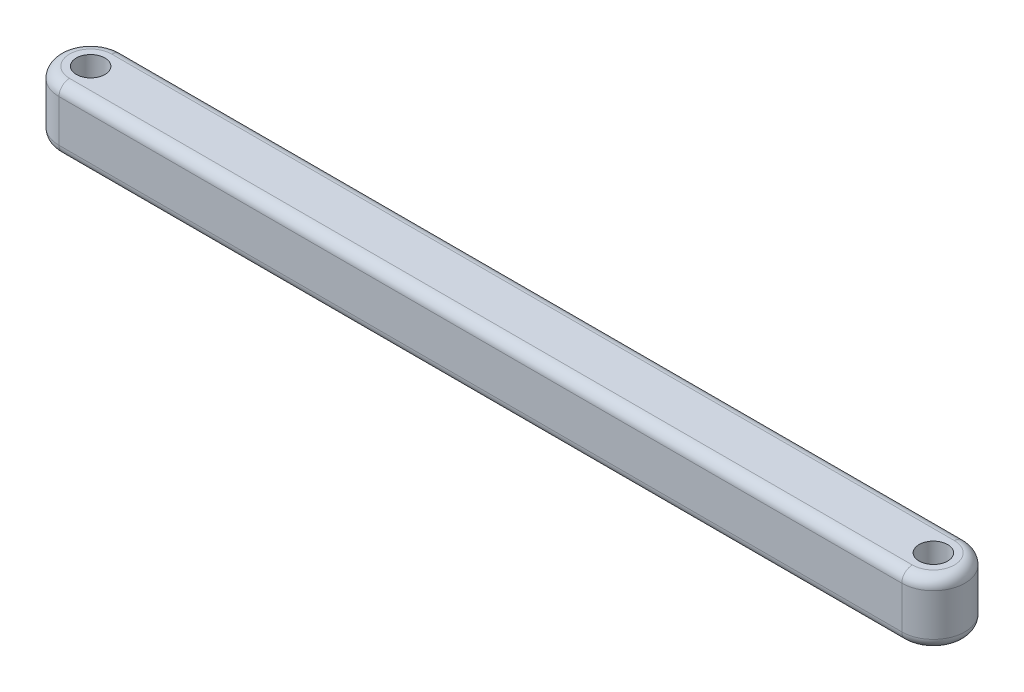
from build123d import *

# Parameters (mm, degrees)
BOSS_EXTRUDE1_DEPTH = 4.7625
SKETCH2_R           = 2.159
CUT_EXTRUDE1_DEPTH  = 133.192145899
FILLET1_R           = 1.5875


with BuildPart() as part:
    # Sketch1 → Boss-Extrude1 (new, symmetric)
    with BuildSketch(Plane(origin=(0, 0, 0), x_dir=(1, 0, 0), z_dir=(0, 1, 0))):
        with BuildLine():
            Line((0, 4.7625), (127, 4.7625))
            ThreePointArc((127, 4.7625), (131.7625, 0), (127, -4.7625))
            Line((127, -4.7625), (0, -4.7625))
            ThreePointArc((0, -4.7625), (-4.7625, 0), (0, 4.7625))
        make_face()
    extrude(amount=BOSS_EXTRUDE1_DEPTH, both=True)

    # Sketch2 → Cut-Extrude1 (cut, through all)
    with BuildSketch(Plane(origin=(0, 4.7625, 0), x_dir=(1, 0, 0), z_dir=(0, 1, 0))):
        Circle(SKETCH2_R)
        with Locations((127, 0)):
            Circle(SKETCH2_R)
    extrude(amount=-CUT_EXTRUDE1_DEPTH, mode=Mode.SUBTRACT)

    # Fillet1
    fillet1_edges = [part.edges().sort_by_distance(p)[0] for p in [
        (131.7625, -4.7625, 0),
        (63.5, -4.7625, 4.7625),
        (-4.7625, -4.7625, 0),
        (131.7625, 4.7625, 0),
        (63.5, 4.7625, 4.7625),
        (-4.7625, 4.7625, 0),
        (63.5, -4.7625, -4.7625),
        (63.5, 4.7625, -4.7625),
    ]]
    fillet(fillet1_edges, radius=FILLET1_R)


solid = part.part
